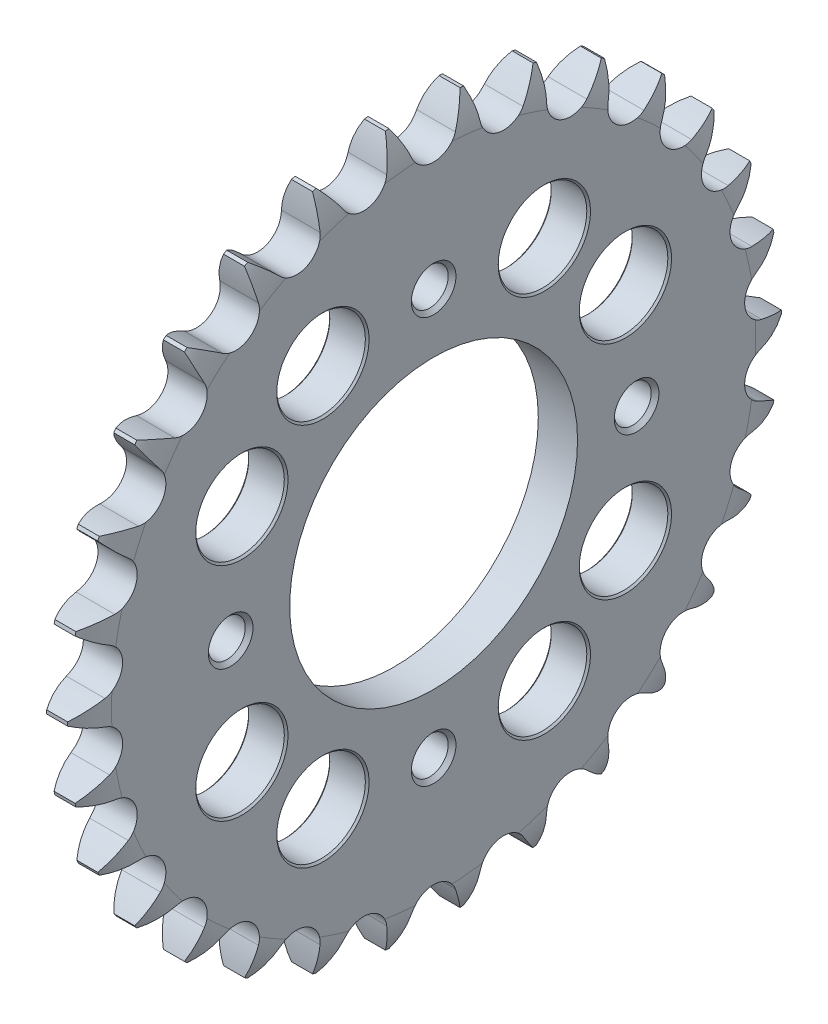
from build123d import *

# Parameters (mm, degrees)
TOOTHCUT_DEPTH               = 69.569568456
TEETHCUTS_COUNT              = 30
TEETHCUTS_ANGLE              = 348
BORSKE_R                     = 2
BORE_DEPTH                   = 50.0005
SKETCH1_R                    = 19.5
CUT_EXTRUDE1_DEPTH           = 10
M6_TAPPED_HOLE1_D            = 5
M6_TAPPED_HOLE1_CSINK_D      = 6.05
M6_TAPPED_HOLE1_CSINK_ANGLE  = 90
F_12_0_12_DIAMETER_HOLE1_D   = 12
CHAMFER1_SIZE                = 0.25
CIRPATTERN1_COUNT            = 12
CHAMFER1_OF_CIRPATTERN1_SIZE = 0.25


with BuildPart() as part:
    # BasProSke → Base-Revolve (revolve)
    with BuildSketch(Plane(origin=(0, 0, 0), x_dir=(1, 0, 0), z_dir=(0, 1, 0)), mode=Mode.PRIVATE) as base_revolve_sk:
        with BuildLine():
            Line((0, 0), (0, 43.644001325))
            ThreePointArc((0, 43.644001325), (0.314698702, 46.072164211), (1.238, 48.339877814))
            Line((1.238, 48.339877814), (4.0816, 48.339877814))
            ThreePointArc((4.0816, 48.339877814), (5.004901298, 46.072164211), (5.3196, 43.644001325))
            Line((5.3196, 43.644001325), (5.3196, 0))
            Line((5.3196, 0), (0, 0))
        make_face()
    revolve(base_revolve_sk.sketch.rotate(Axis((-10, 0, 0), (1, 0, 0)), 180), axis=Axis((-10, 0, 0), (1, 0, 0)))

    # TooCutSke → ToothCut (cut, through all)
    with BuildSketch(Plane(origin=(0, 0, 0), x_dir=(0, 0, -1), z_dir=(1, 0, 0))):
        with BuildLine():
            ThreePointArc((2.983616536, 44.418225005), (3.941917717, 46.546267287), (5.099276911, 48.572945555))
            ThreePointArc((5.099276911, 48.572945555), (0, 48.839877814), (-5.099276911, 48.572945555))
            ThreePointArc((-5.099276911, 48.572945555), (-3.941917717, 46.546267287), (-2.983616536, 44.418225005))
            ThreePointArc((-2.983616536, 44.418225005), (0, 42.386752814), (2.983616536, 44.418225005))
        make_face()
    toothcut = extrude(amount=TOOTHCUT_DEPTH, mode=Mode.SUBTRACT)

    # TeethCuts: ToothCut ×30 about axis
    teethcuts_axis = Axis((-10, 0, 0), (1, 0, 0))
    for i in range(1, TEETHCUTS_COUNT):
        add(toothcut.rotate(teethcuts_axis, i * TEETHCUTS_ANGLE / (TEETHCUTS_COUNT - 1)), mode=Mode.SUBTRACT)

    # BorSke → Bore (cut, symmetric)
    with BuildSketch(Plane(origin=(0, 0, 0), x_dir=(0, 0, -1), z_dir=(1, 0, 0))):
        with Locations(Location((0, 0, 0), (0, 0, 180))):
            Circle(BORSKE_R)
    extrude(amount=BORE_DEPTH, both=True, mode=Mode.SUBTRACT)

    # Sketch1 → Cut-Extrude1 (cut)
    with BuildSketch(Plane(origin=(5.3196, 0, 0), x_dir=(0, 0, -1), z_dir=(1, 0, 0))):
        Circle(SKETCH1_R)
    extrude(amount=-CUT_EXTRUDE1_DEPTH, mode=Mode.SUBTRACT)

    # M6 Tapped Hole1 (through all)
    with Locations(Plane(origin=(5.3196, 0, 0), x_dir=(0, 0, -1), z_dir=(1, 0, 0))):
        with Locations((0, 27.5), (-27.5, 0), (27.5, 0), (0, -27.5)):
            CounterSinkHole(M6_TAPPED_HOLE1_D / 2, M6_TAPPED_HOLE1_CSINK_D / 2, counter_sink_angle=M6_TAPPED_HOLE1_CSINK_ANGLE)

    # Ø12.0 (12) Diameter Hole1 (through all)
    with Locations(Plane(origin=(5.3196, 0, 0), x_dir=(0, 0, -1), z_dir=(1, 0, 0))):
        with Locations((15, 25.980762114)):
            f_12_0_12_diameter_hole1 = Hole(F_12_0_12_DIAMETER_HOLE1_D / 2)

    # Chamfer1
    chamfer1_edges = [part.edges().sort_by_distance(p)[0] for p in [
        (5.3196, 25.980762114, -21),
        (0, 25.980762114, -21),
    ]]
    chamfer(chamfer1_edges, length=CHAMFER1_SIZE)

    # CirPattern1: Ø12.0 (12) Diameter Hole1 ×12 about axis, 4 skipped
    cirpattern1_axis = Axis((-4.6804, 0, 0), (1, 0, 0))
    add([f_12_0_12_diameter_hole1.rotate(cirpattern1_axis, i * 360 / CIRPATTERN1_COUNT) for i in range(1, CIRPATTERN1_COUNT) if i not in (1, 4, 7, 10)], mode=Mode.SUBTRACT)

    # Chamfer1 of CirPattern1
    chamfer1_of_cirpattern1_edges = [part.edges().sort_by_distance(p)[0] for p in [
        (5.3196, 31.176914536, 12),
        (0, 31.176914536, 12),
        (5.3196, 21, 25.980762114),
        (0, 21, 25.980762114),
        (5.3196, -12, 31.176914536),
        (0, -12, 31.176914536),
        (5.3196, -25.980762114, 21),
        (0, -25.980762114, 21),
        (5.3196, -31.176914536, -12),
        (0, -31.176914536, -12),
        (5.3196, -21, -25.980762114),
        (0, -21, -25.980762114),
        (5.3196, 12, -31.176914536),
        (0, 12, -31.176914536),
    ]]
    chamfer(chamfer1_of_cirpattern1_edges, length=CHAMFER1_OF_CIRPATTERN1_SIZE)


solid = part.part
